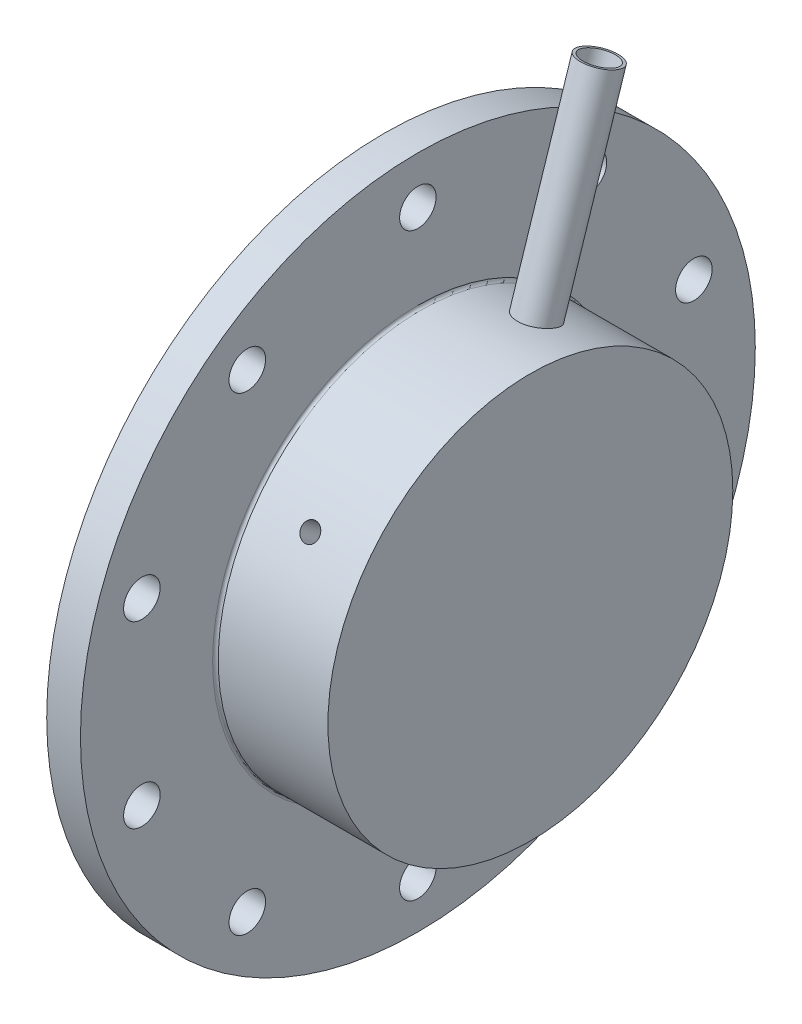
from build123d import *

# Parameters (mm, degrees)
SKETCH1_R                            = 60
SKETCH1_R_2                          = 31
SKETCH1_R_3                          = 3.25
BOSS_EXTRUDE1_DEPTH                  = 6
SKETCH8_R                            = 36
SKETCH8_R_2                          = 3
BOSS_EXTRUDE2_DEPTH                  = 20
FILLET1_R                            = 0.5
SKETCH29_R                           = 3
CUT_EXTRUDE1_DEPTH                   = 51
SKETCH32_R                           = 3.5
SKETCH32_R_2                         = 3
BOSS_EXTRUDE4_DEPTH                  = 36
BOSS_EXTRUDE4_DIRECTION_2_REACH      = 122.895
BOSS_EXTRUDE4_DIRECTION_2_END_RADIUS = 36
BOSS_EXTRUDE5_START                  = -7
SKETCH34_R                           = 3
BOSS_EXTRUDE5_DEPTH                  = 7


with BuildPart() as part:
    # Sketch1 → Boss-Extrude1 (new body)
    with BuildSketch(Plane(origin=(0, 0, 0), x_dir=(0, 0, -1), z_dir=(1, 0, 0))):
        Circle(SKETCH1_R)
        Circle(SKETCH1_R_2, mode=Mode.SUBTRACT)
        with Locations((0, 51.6)):
            Circle(SKETCH1_R_3, mode=Mode.SUBTRACT)
        with Locations((30.329719018, 41.74527691)):
            Circle(SKETCH1_R_3, mode=Mode.SUBTRACT)
        with Locations((49.074516241, 15.94527691)):
            Circle(SKETCH1_R_3, mode=Mode.SUBTRACT)
        with Locations((49.074516241, -15.94527691)):
            Circle(SKETCH1_R_3, mode=Mode.SUBTRACT)
        with Locations((30.329719018, -41.74527691)):
            Circle(SKETCH1_R_3, mode=Mode.SUBTRACT)
        with Locations((0, -51.6)):
            Circle(SKETCH1_R_3, mode=Mode.SUBTRACT)
        with Locations((-30.329719018, -41.74527691)):
            Circle(SKETCH1_R_3, mode=Mode.SUBTRACT)
        with Locations((-49.074516241, -15.94527691)):
            Circle(SKETCH1_R_3, mode=Mode.SUBTRACT)
        with Locations((-49.074516241, 15.94527691)):
            Circle(SKETCH1_R_3, mode=Mode.SUBTRACT)
        with Locations((-30.329719018, 41.74527691)):
            Circle(SKETCH1_R_3, mode=Mode.SUBTRACT)
    extrude(amount=BOSS_EXTRUDE1_DEPTH)

    # Sketch8 → Boss-Extrude2 (add)
    with BuildSketch(Plane(origin=(6, 0, 0), x_dir=(0, 0, -1), z_dir=(1, 0, 0))):
        Circle(SKETCH8_R)
        Circle(SKETCH8_R_2, mode=Mode.SUBTRACT)
    extrude(amount=BOSS_EXTRUDE2_DEPTH)

    # Sketch16 → Cut-Revolve4 (revolve, cut)
    with BuildSketch(Plane(origin=(16, 0, 0), x_dir=(0, 0, -1), z_dir=(1, 0, 0))):
        Polygon((44.335236369, 32.211434711), (43.394779965, 33.505861902), (0, 1.977708764), (0, 0), align=None)
    revolve(axis=Axis((16, 0, 0), (0, 0.5877852522924714, -0.8090169943749488)), mode=Mode.SUBTRACT)

    # Sketch28 → Cut-Revolve5 (revolve, cut)
    with BuildSketch(Plane(origin=(16, 0, -13), x_dir=(0, 0, 1), z_dir=(-1, 0, 0))):
        Polygon((48.826625906, 26.029567355), (47.886169502, 27.323994546), (13, 1.977708764), (13, 0), align=None)
    revolve(axis=Axis((16, -6.181867356, -8.508610463), (0, 0.5877852522924714, 0.8090169943749487)), mode=Mode.SUBTRACT)

    # Fillet1
    fillet1_edges = [part.edges().sort_by_distance(p)[0] for p in [
        (6, 0, 36),
    ]]
    fillet(fillet1_edges, radius=FILLET1_R)

    # Sketch29 → Cut-Extrude1 (cut)
    with BuildSketch(Plane(origin=(0, 0, 0), x_dir=(1, 0, 0), z_dir=(0, 0.9510565162951523, -0.3090169943749514))):
        with Locations((16, 0)):
            Circle(SKETCH29_R)
    extrude(amount=CUT_EXTRUDE1_DEPTH, mode=Mode.SUBTRACT)

    # Sketch32 → Boss-Extrude4 (add)
    with BuildSketch(Plane(origin=(0, 34.238034587, -11.124611797), x_dir=(-1, 0, 0), z_dir=(0, 0.9510565162951523, -0.3090169943749514))):
        with Locations((-16, 0)):
            Circle(SKETCH32_R)
        with Locations((-16, 0)):
            Circle(SKETCH32_R_2, mode=Mode.SUBTRACT)
    extrude(amount=BOSS_EXTRUDE4_DEPTH)

    # Boss-Extrude4 direction 2: up to this cylinder (the profile starts outside it)
    boss_extrude4_direction_2_end = Plane(origin=(19.401005, 0, 0), z_dir=(-1, 0, 0)) * Cylinder(BOSS_EXTRUDE4_DIRECTION_2_END_RADIUS, 318.79, mode=Mode.PRIVATE)
    # Sketch32 → Boss-Extrude4 direction 2 (add, up to the surface)
    with BuildSketch(Plane(origin=(0, 34.238034587, -11.124611797), x_dir=(-1, 0, 0), z_dir=(0, 0.9510565162951523, -0.3090169943749514)), mode=Mode.PRIVATE) as boss_extrude4_direction_2_sk1:
        with Locations((-16, 0)):
            Circle(SKETCH32_R)
        with Locations((-16, 0)):
            Circle(SKETCH32_R_2, mode=Mode.SUBTRACT)
    boss_extrude4_direction_2_tool1 = extrude(boss_extrude4_direction_2_sk1.sketch, amount=-BOSS_EXTRUDE4_DIRECTION_2_REACH, mode=Mode.PRIVATE) - boss_extrude4_direction_2_end
    add(boss_extrude4_direction_2_tool1.solids().sort_by_distance((19.401005, 34.238035, -11.124612))[0])
    add(boss_extrude4_direction_2_tool1.solids().sort_by_distance((19.401005, 34.238035, -11.124612))[1])

    # Sketch33 → Cut-Revolve6 (revolve, cut)
    with BuildSketch(Plane.XY):
        with BuildLine():
            Line((0, 46.545), (2.17, 46.545))
            ThreePointArc((2.17, 46.545), (2.523553391, 46.398553391), (2.67, 46.045))
            Line((2.67, 46.045), (2.67, 42.445))
            ThreePointArc((2.67, 42.445), (2.523553391, 42.091446609), (2.17, 41.945))
            Line((2.17, 41.945), (0, 41.945))
            Line((0, 41.945), (0, 46.545))
        make_face()
        with BuildLine():
            Line((0, 40.195), (2.17, 40.195))
            ThreePointArc((2.17, 40.195), (2.523553391, 40.048553391), (2.67, 39.695))
            Line((2.67, 39.695), (2.67, 36.095))
            ThreePointArc((2.67, 36.095), (2.523553391, 35.741446609), (2.17, 35.595))
            Line((2.17, 35.595), (0, 35.595))
            Line((0, 35.595), (0, 40.195))
        make_face()
    revolve(axis=Axis((26, 0, 0), (-1, 0, 0)), mode=Mode.SUBTRACT)

    # Sketch34 → Boss-Extrude5 (add)
    with BuildSketch(Plane(origin=(26, 0, 0), x_dir=(0, 0, -1), z_dir=(1, 0, 0)).offset(BOSS_EXTRUDE5_START)):
        Circle(SKETCH34_R)
    extrude(amount=BOSS_EXTRUDE5_DEPTH)


solid = part.part
